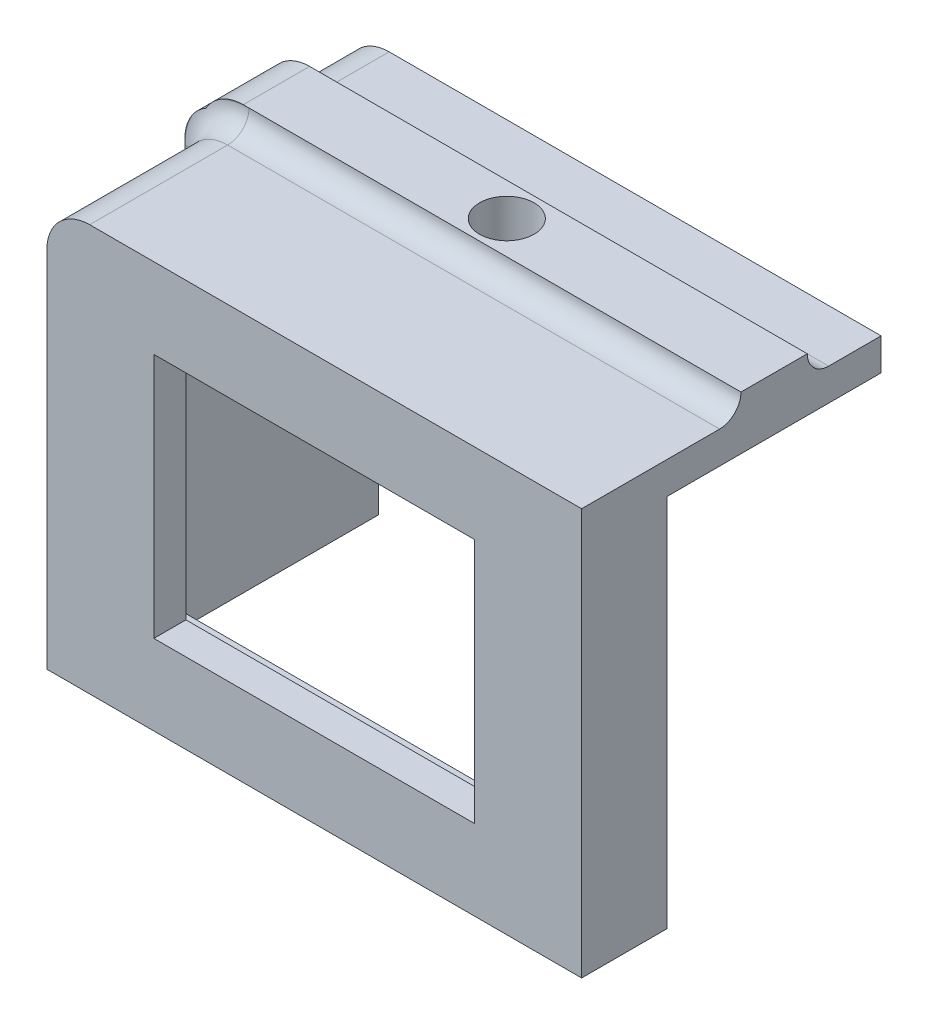
from build123d import *
from build123d.topology import SkipClean

# Parameters (mm, degrees)
SKETCH_1_W          = 44
SKETCH_1_H          = 32
SKETCH_1_W_2        = 30
SKETCH_1_H_2        = 23
EXTRUDE_1_DEPTH     = 3
SKETCH_1_3_W        = 3
SKETCH_1_3_H        = 3
EXTRUDE_2_DEPTH     = 28
EXTRUDE_3_DEPTH     = 8
SKETCH_2_R          = 2.55
CUT_EXTRUDE_2_DEPTH = 61.373835392
EXTRUDE_START       = 2
SKETCH_2_3_W        = 6.2
SKETCH_2_3_H        = 38
SKETCH_2_3_R        = 2.55
EXTRUDE_4_DEPTH     = 2
SKETCH_3_W          = 50
SKETCH_3_H          = 6.2
SKETCH_3_R          = 2.55
EXTRUDE_5_DEPTH     = 2
SKETCH_3_2_R        = 2.55
CUT_EXTRUDE_3_DEPTH = 55.378304497
FILLET_2_R          = 4
FILLET_3_R          = 2
FILLET_4_R          = 4


with BuildPart() as part:
    # 草图1 → 凸台-拉伸1 (new body)
    with BuildSketch(Plane.XY):
        Rectangle(SKETCH_1_W, SKETCH_1_H)
        Rectangle(SKETCH_1_W_2, SKETCH_1_H_2, mode=Mode.SUBTRACT)
    extrude(amount=-EXTRUDE_1_DEPTH)

    # 草图1<3> → 凸台-拉伸2 (add)
    with BuildSketch(Plane.XY):
        Polygon((-22, -16), (-22, 16), (22, 16), (22, 19), (-25, 19), (-25, -16), align=None)
        with Locations((-23.5, -17.5)):
            Rectangle(SKETCH_1_3_W, SKETCH_1_3_H)
        with Locations((23.5, 17.5)):
            Rectangle(SKETCH_1_3_W, SKETCH_1_3_H)
    extrude(amount=-EXTRUDE_2_DEPTH)

    # 草图1<4> → 凸台-拉伸3 (add)
    with BuildSketch(Plane.XY):
        Polygon((25, 16), (22, 16), (22, -16), (-22, -16), (-22, -19), (25, -19), align=None)
    extrude(amount=-EXTRUDE_3_DEPTH)

    # 草图2 → 切除-拉伸2 (cut, through all)
    with BuildSketch(Plane.ZY.offset(25)):
        with Locations((-18, 0)):
            Circle(SKETCH_2_R)
    extrude(amount=-CUT_EXTRUDE_2_DEPTH, mode=Mode.SUBTRACT)

    # 草图2<3> → 凸台-拉伸4 (add)
    with BuildSketch(Plane.ZY.offset(25).offset(EXTRUDE_START)):
        with Locations((-18, 0)):
            Rectangle(SKETCH_2_3_W, SKETCH_2_3_H)
        with Locations((-18, 0)):
            Circle(SKETCH_2_3_R, mode=Mode.SUBTRACT)
    extrude(amount=-EXTRUDE_4_DEPTH)

    # 草图3 → 凸台-拉伸5 (add)
    with BuildSketch(Plane(origin=(0, 19, 0), x_dir=(1, 0, 0), z_dir=(0, 1, 0))):
        with Locations((0, 18)):
            Rectangle(SKETCH_3_W, SKETCH_3_H)
        with Locations(Location((0, 18, 0), (0, 0, 270))):
            Circle(SKETCH_3_R, mode=Mode.SUBTRACT)
    extrude(amount=EXTRUDE_5_DEPTH)

    # 草图3<2> → 切除-拉伸3 (cut, through all)
    with SkipClean():  # the faces are left unmerged after this step: merging them gives an invalid solid
        with BuildSketch(Plane(origin=(0, 19, 0), x_dir=(1, 0, 0), z_dir=(0, 1, 0))):
            with Locations(Location((0, 18, 0), (0, 0, 90))):
                Circle(SKETCH_3_2_R)
        extrude(amount=-CUT_EXTRUDE_3_DEPTH, mode=Mode.SUBTRACT)
    add(part.part.scale(1), mode=Mode.REPLACE)  # the faces are merged on a copy

    # 圆角2
    # the kernel refuses this fillet: 4 mm, written as the material it takes off along each edge
    with BuildSketch(Plane(origin=(-25, 19, -11.1), x_dir=(1, 0, 0), z_dir=(0, 0, -1))) as fillet_2_piece_1_section:
        with BuildLine():
            CenterArc((FILLET_2_R, FILLET_2_R), FILLET_2_R, 180, 90)
            Line((0, FILLET_2_R), (0, 0))
            Line((0, 0), (FILLET_2_R, 0))
        make_face()
    fillet_2_piece_1 = extrude(amount=26.9, mode=Mode.PRIVATE)
    fillet_2_piece_1 = split(fillet_2_piece_1, bisect_by=Plane(origin=(-24.094419543, 18.094419543, -14.9), z_dir=(0, 0, 1)), keep=Keep.TOP, mode=Mode.PRIVATE)
    add(fillet_2_piece_1, mode=Mode.SUBTRACT)
    with BuildSketch(Plane(origin=(-25, 19, -21.1), x_dir=(1, 0, 0), z_dir=(0, 0, -1))) as fillet_2_piece_2:
        with BuildLine():
            CenterArc((FILLET_2_R, FILLET_2_R), FILLET_2_R, 180, 90)
            Line((0, FILLET_2_R), (0, 0))
            Line((0, 0), (FILLET_2_R, 0))
        make_face()
    extrude(amount=16.9, mode=Mode.SUBTRACT)
    with BuildSketch(Plane(origin=(-25, 19, 10), x_dir=(1, 0, 0), z_dir=(0, 0, -1))) as fillet_2_piece_3:
        with BuildLine():
            CenterArc((FILLET_2_R, FILLET_2_R), FILLET_2_R, 180, 90)
            Line((0, FILLET_2_R), (0, 0))
            Line((0, 0), (FILLET_2_R, 0))
        make_face()
    extrude(amount=24.9, mode=Mode.SUBTRACT)
    with BuildSketch(Plane(origin=(-25, 19, 10), x_dir=(1, 0, 0), z_dir=(0, 0, -1))) as fillet_2_piece_4_section:
        with BuildLine():
            CenterArc((FILLET_2_R, FILLET_2_R), FILLET_2_R, 180, 90)
            Line((0, FILLET_2_R), (0, 0))
            Line((0, 0), (FILLET_2_R, 0))
        make_face()
    fillet_2_piece_4 = extrude(amount=34.9, mode=Mode.PRIVATE)
    fillet_2_piece_4 = split(fillet_2_piece_4, bisect_by=Plane(origin=(-24.094419543, 18.094419543, -21.1), z_dir=(0, 0, -1)), keep=Keep.TOP, mode=Mode.PRIVATE)
    add(fillet_2_piece_4, mode=Mode.SUBTRACT)

    # 圆角3
    # the kernel refuses this fillet: 2 mm, written as the material it adds along each edge
    with BuildSketch(Plane(origin=(-25, 15, -14.9), x_dir=(0, 0, 1), z_dir=(0, -1, 0)), Plane(origin=(-25, -19, -21.1), x_dir=(0, 0, -1), z_dir=(0, 1, 0))) as fillet_3_piece_1:
        with BuildLine():
            CenterArc((FILLET_3_R, FILLET_3_R), FILLET_3_R, 180, 90)
            Line((0, FILLET_3_R), (0, 0))
            Line((0, 0), (FILLET_3_R, 0))
        make_face()
    extrude(amount=34)
    with BuildSketch(Plane(origin=(-21, 19, -14.9), x_dir=(0, 1, 0), z_dir=(1, 0, 0))) as fillet_3_piece_2:
        with BuildLine():
            CenterArc((FILLET_3_R, FILLET_3_R), FILLET_3_R, 180, 90)
            Line((0, FILLET_3_R), (0, 0))
            Line((0, 0), (FILLET_3_R, 0))
        make_face()
    extrude(amount=46)
    with BuildSketch(Plane(origin=(-21, 15, -14.9), x_dir=(0, 1, 0), z_dir=(1, 0, 0))) as fillet_3_piece_3_section:
        with BuildLine():
            CenterArc((4 + FILLET_3_R, FILLET_3_R), FILLET_3_R, 180, 90)
            Line((4, FILLET_3_R), (4, 0))
            Line((4, 0), (4 + FILLET_3_R, 0))
        make_face()
    fillet_3_piece_3 = revolve(axis=Axis((-21, 15, -14.9), (0, 0, 1)), revolution_arc=90, mode=Mode.PRIVATE)
    fillet_3_piece_3 = split(fillet_3_piece_3, bisect_by=Plane(origin=(-25, 19.477397307, -14.620539083), z_dir=(1, 0, 0)), keep=Keep.TOP, mode=Mode.PRIVATE)
    fillet_3_piece_3 = split(fillet_3_piece_3, bisect_by=Plane(origin=(-22.217423946, 19, -14.620539083), z_dir=(0, 1, 0)), keep=Keep.TOP, mode=Mode.PRIVATE)
    add(fillet_3_piece_3)
    with BuildSketch(Plane(origin=(-21, 15, -14.9), x_dir=(0, 1, 0), z_dir=(1, 0, 0))) as fillet_3_piece_4_section:
        with BuildLine():
            CenterArc((4 + FILLET_3_R, FILLET_3_R), FILLET_3_R, 180, 90)
            Line((4, FILLET_3_R), (4, 0))
            Line((4, 0), (4 + FILLET_3_R, 0))
        make_face()
    fillet_3_piece_4 = revolve(axis=Axis((-21, 15, -14.9), (0, 0, 1)), revolution_arc=90, mode=Mode.PRIVATE)
    fillet_3_piece_4 = split(fillet_3_piece_4, bisect_by=Plane(origin=(-25, 17.874086427, -14.313906434), z_dir=(1, 0, 0)), keep=Keep.TOP, mode=Mode.PRIVATE)
    fillet_3_piece_4 = split(fillet_3_piece_4, bisect_by=Plane(origin=(-23.874086368, 19, -14.313906434), z_dir=(0, -1, 0)), keep=Keep.TOP, mode=Mode.PRIVATE)
    add(fillet_3_piece_4)
    with BuildSketch(Plane(origin=(-21, 15, -14.9), x_dir=(0, 1, 0), z_dir=(1, 0, 0))) as fillet_3_piece_5_section:
        with BuildLine():
            CenterArc((4 + FILLET_3_R, FILLET_3_R), FILLET_3_R, 180, 90)
            Line((4, FILLET_3_R), (4, 0))
            Line((4, 0), (4 + FILLET_3_R, 0))
        make_face()
    fillet_3_piece_5 = revolve(axis=Axis((-21, 15, -14.9), (0, 0, 1)), revolution_arc=90, mode=Mode.PRIVATE)
    fillet_3_piece_5 = split(fillet_3_piece_5, bisect_by=Plane(origin=(-25, 16.217423741, -14.620538996), z_dir=(-1, 0, 0)), keep=Keep.TOP, mode=Mode.PRIVATE)
    fillet_3_piece_5 = split(fillet_3_piece_5, bisect_by=Plane(origin=(-25.477396893, 19, -14.620538996), z_dir=(0, -1, 0)), keep=Keep.TOP, mode=Mode.PRIVATE)
    add(fillet_3_piece_5)
    with BuildSketch(Plane(origin=(25, 19, -21.1), x_dir=(0, 0, -1), z_dir=(-1, 0, 0))) as fillet_3_piece_6:
        with BuildLine():
            CenterArc((FILLET_3_R, -FILLET_3_R), FILLET_3_R, 90, 90)
            Line((0, -FILLET_3_R), (0, 0))
            Line((0, 0), (FILLET_3_R, 0))
        make_face()
    extrude(amount=46)
    with BuildSketch(Plane(origin=(-21, 15, -21.1), x_dir=(-1, 0, 0), z_dir=(0, -1, 0))) as fillet_3_piece_7_section:
        with BuildLine():
            CenterArc((4 + FILLET_3_R, FILLET_3_R), FILLET_3_R, 180, 90)
            Line((4 + FILLET_3_R, 0), (4, 0))
            Line((4, 0), (4, FILLET_3_R))
        make_face()
    fillet_3_piece_7 = revolve(axis=Axis((-21, 15, -21.1), (0, 0, -1)), revolution_arc=90, mode=Mode.PRIVATE)
    fillet_3_piece_7 = split(fillet_3_piece_7, bisect_by=Plane(origin=(-25, 17.874086364, -21.686093558), z_dir=(1, 0, 0)), keep=Keep.TOP, mode=Mode.PRIVATE)
    fillet_3_piece_7 = split(fillet_3_piece_7, bisect_by=Plane(origin=(-23.874086351, 19, -21.686093558), z_dir=(0, -1, 0)), keep=Keep.TOP, mode=Mode.PRIVATE)
    add(fillet_3_piece_7)
    with BuildSketch(Plane(origin=(-21, 15, -21.1), x_dir=(-1, 0, 0), z_dir=(0, -1, 0))) as fillet_3_piece_8_section:
        with BuildLine():
            CenterArc((4 + FILLET_3_R, FILLET_3_R), FILLET_3_R, 180, 90)
            Line((4 + FILLET_3_R, 0), (4, 0))
            Line((4, 0), (4, FILLET_3_R))
        make_face()
    fillet_3_piece_8 = revolve(axis=Axis((-21, 15, -21.1), (0, 0, -1)), revolution_arc=90, mode=Mode.PRIVATE)
    fillet_3_piece_8 = split(fillet_3_piece_8, bisect_by=Plane(origin=(-25, 16.217424103, -21.379460891), z_dir=(-1, 0, 0)), keep=Keep.TOP, mode=Mode.PRIVATE)
    fillet_3_piece_8 = split(fillet_3_piece_8, bisect_by=Plane(origin=(-25.477397304, 19, -21.379460891), z_dir=(0, -1, 0)), keep=Keep.TOP, mode=Mode.PRIVATE)
    add(fillet_3_piece_8)
    with BuildSketch(Plane(origin=(-21, 15, -21.1), x_dir=(-1, 0, 0), z_dir=(0, -1, 0))) as fillet_3_piece_9_section:
        with BuildLine():
            CenterArc((4 + FILLET_3_R, FILLET_3_R), FILLET_3_R, 180, 90)
            Line((4 + FILLET_3_R, 0), (4, 0))
            Line((4, 0), (4, FILLET_3_R))
        make_face()
    fillet_3_piece_9 = revolve(axis=Axis((-21, 15, -21.1), (0, 0, -1)), revolution_arc=90, mode=Mode.PRIVATE)
    fillet_3_piece_9 = split(fillet_3_piece_9, bisect_by=Plane(origin=(-25, 19.477396901, -21.379461023), z_dir=(1, 0, 0)), keep=Keep.TOP, mode=Mode.PRIVATE)
    fillet_3_piece_9 = split(fillet_3_piece_9, bisect_by=Plane(origin=(-22.217423514, 19, -21.379461023), z_dir=(0, 1, 0)), keep=Keep.TOP, mode=Mode.PRIVATE)
    add(fillet_3_piece_9)

    # 圆角4
    # the kernel refuses this fillet: 4 mm, written as the material it takes off along each edge
    with BuildSketch(Plane(origin=(-25, 21, -29.760254038), x_dir=(1, 0, 0), z_dir=(0, 0, 1))) as fillet_4_piece_1:
        with BuildLine():
            CenterArc((3.464101615, -4), FILLET_4_R, 90, 60)
            Line((0, -2), (-0.069282032, -1.96))
            ThreePointArc((-0.069282032, -1.96), (-0.08, -1), (-0.08, 0))
            Line((-0.08, 0), (0, 0.08))
            Line((0, 0.08), (3.464101615, 0.08))
            Line((3.464101615, 0.08), (3.464101615, 0))
        make_face()
    extrude(amount=23.520508076, mode=Mode.SUBTRACT)
    with BuildSketch(Plane(origin=(-27, 19, -29.760254038), x_dir=(0, -1, 0), z_dir=(0, 0, 1))) as fillet_4_piece_2:
        with BuildLine():
            CenterArc((3.464101615, 4), FILLET_4_R, 210, 60)
            Line((0, 2), (-0.069282032, 1.96))
            ThreePointArc((-0.069282032, 1.96), (-0.08, 1), (-0.08, 0))
            Line((-0.08, 0), (0, -0.08))
            Line((0, -0.08), (3.464101615, -0.08))
            Line((3.464101615, -0.08), (3.464101615, 0))
        make_face()
    extrude(amount=23.520508076, mode=Mode.SUBTRACT)


solid = part.part
